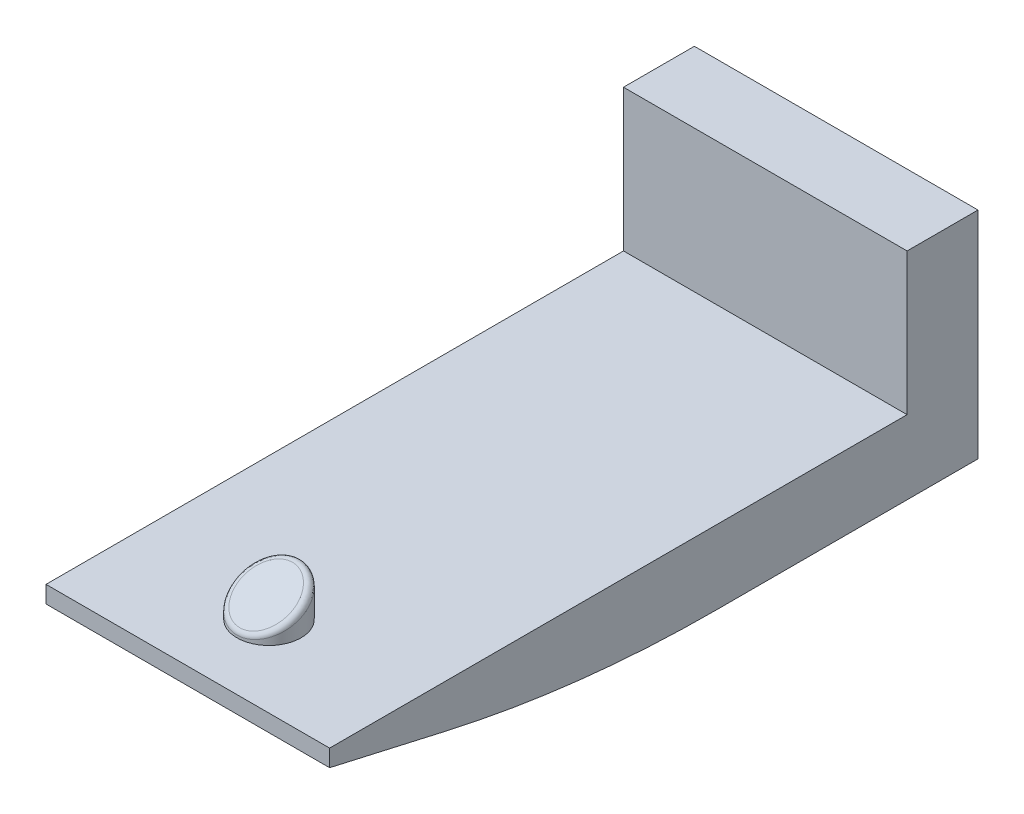
from build123d import *

# Parameters (mm, degrees)
BOSS_EXTRUDE1_DEPTH = 12.7
SKETCH2_R           = 1.4351
BOSS_EXTRUDE2_DEPTH = 3.81
CUT_EXTRUDE1_DEPTH  = 34.12884745
FILLET1_R           = 0.254


with BuildPart() as part:
    # Sketch1 → Boss-Extrude1 (new body)
    with BuildSketch(Plane(origin=(0, 0, 0), x_dir=(0, 0, -1), z_dir=(1, 0, 0))):
        with BuildLine():
            ThreePointArc((-23.9, 1.3716), (-17.832549445, 0.343974693), (-11.688312193, 0))
            Line((-11.688312193, 0), (0, 0))
            Line((0, 0), (0, 9.652))
            Line((0, 9.652), (-3.175, 9.652))
            Line((-3.175, 9.652), (-3.175, 3.302))
            Line((-3.175, 3.302), (-29.035657895, 3.302))
            Line((-29.035657895, 3.302), (-29.035657895, 2.54))
            Line((-29.035657895, 2.54), (-23.9, 1.3716))
        make_face()
    extrude(amount=BOSS_EXTRUDE1_DEPTH)

    # Sketch2 → Boss-Extrude2 (add)
    with BuildSketch(Plane(origin=(0, 3.302, 0), x_dir=(1, 0, 0), z_dir=(0, 1, 0))):
        with Locations((6.35, -25.4)):
            Circle(SKETCH2_R)
    extrude(amount=BOSS_EXTRUDE2_DEPTH)

    # Sketch3 → Cut-Extrude1 (cut, through all)
    with BuildSketch(Plane(origin=(12.7, 0, 0), x_dir=(0, 0, -1), z_dir=(1, 0, 0))):
        Polygon((-26.8351, 3.556), (-23.9649, 5.207), (-23.9649, 7.112), (-26.8351, 7.112), align=None)
    extrude(amount=-CUT_EXTRUDE1_DEPTH, mode=Mode.SUBTRACT)

    # Fillet1
    fillet1_edges = [part.edges().sort_by_distance(p)[0] for p in [
        (7.400106845, 3.818844345, 26.378155215),
    ]]
    fillet(fillet1_edges, radius=FILLET1_R)


solid = part.part
